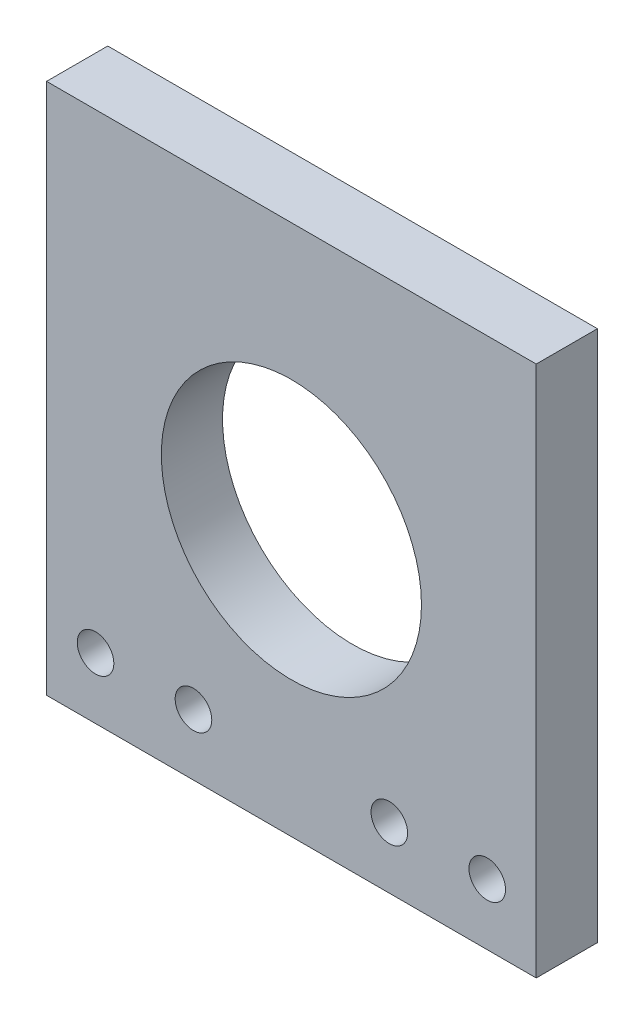
from build123d import *

# Parameters (mm, degrees)
SKETCH1_W             = 50.8
SKETCH1_H             = 55.16372
SKETCH1_R             = 13.49375
BOSS_EXTRUDE1_DEPTH   = 6.35
F_6_CLEARANCE_HOLE1_D = 3.7973


with BuildPart() as part:
    # Sketch1 → Boss-Extrude1 (new body)
    with BuildSketch(Plane.XY):
        Rectangle(SKETCH1_W, SKETCH1_H)
        Circle(SKETCH1_R, mode=Mode.SUBTRACT)
    extrude(amount=BOSS_EXTRUDE1_DEPTH)

    # #6 Clearance Hole1 (through all)
    with Locations(Plane.XY.offset(6.35)):
        with Locations((-20.32, -21.23186), (-10.16, -21.23186), (10.16, -21.23186), (20.32, -21.23186)):
            Hole(F_6_CLEARANCE_HOLE1_D / 2)


solid = part.part
